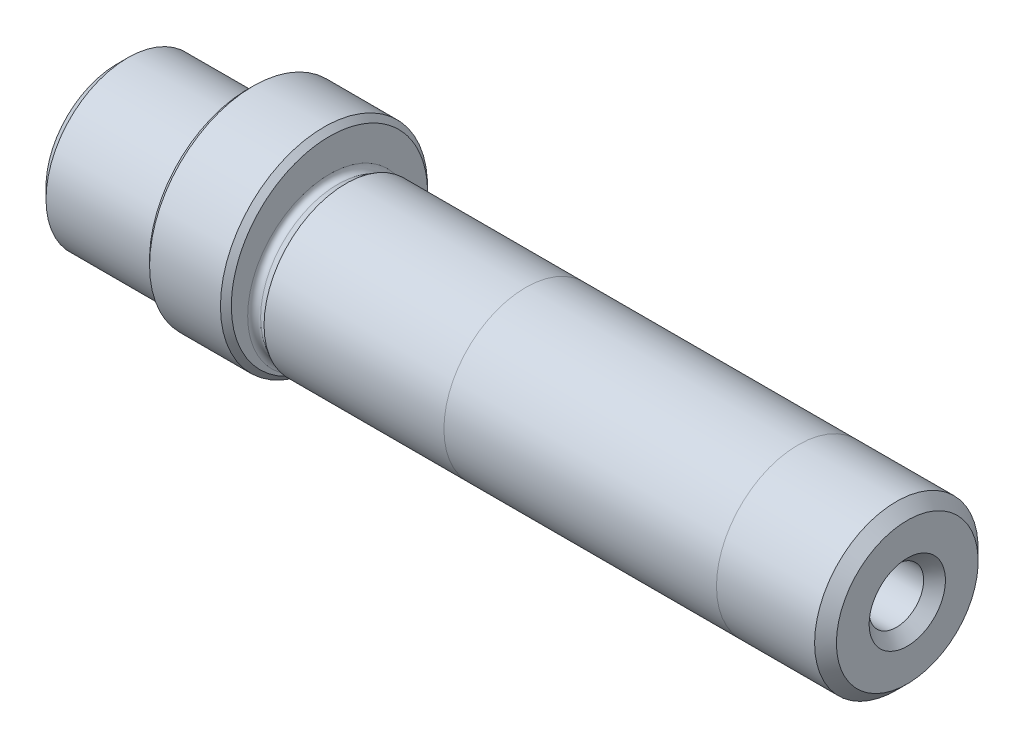
from build123d import *

# Parameters (mm, degrees)
CUT_EXTRUDE1_DEPTH      = 127.059509756
CUT_EXTRUDE1_DEPTH_BACK = 127.059509756
SKETCH3_OUTSIDE_W       = 84.264
SKETCH3_OUTSIDE_H       = 84.264
SKETCH3_OUTSIDE_R       = 19
CHAMFER1_SIZE           = 1
CUT_EXTRUDE2_DEPTH      = 148.885090526
CUT_EXTRUDE2_DEPTH_BACK = 148.885090526
SKETCH6_R               = 5
CHAMFER3_SIZE           = 2


with BuildPart() as part:
    # Sketch2 → Revolve1 (revolve)
    with BuildSketch(Plane.XY, mode=Mode.PRIVATE) as revolve1_sk:
        Polygon((0, 0), (145, 0), (145, 15), (39, 15), (39, 25), (24, 25), (24, 15.2), (0, 15.2), align=None)
    revolve(revolve1_sk.sketch.rotate(Axis((0, 0, 0), (1, 0, 0)), 90), axis=Axis((0, 0, 0), (1, 0, 0)))

    # Sketch3 outside → Cut-Extrude1 (cut, two sides: drawn at the far end of the back side and taken through both)
    with BuildSketch(Plane.ZY.offset(-24).offset(-CUT_EXTRUDE1_DEPTH_BACK)):
        Rectangle(SKETCH3_OUTSIDE_W, SKETCH3_OUTSIDE_H)
        with Locations((0, 3)):
            Circle(SKETCH3_OUTSIDE_R, mode=Mode.SUBTRACT)
    extrude(amount=CUT_EXTRUDE1_DEPTH + CUT_EXTRUDE1_DEPTH_BACK, mode=Mode.SUBTRACT)

    # Sketch4 → Cut-Revolve1 (revolve, cut)
    with BuildSketch(Plane.XY, mode=Mode.PRIVATE) as cut_revolve1_sk:
        with BuildLine():
            Line((-1.227130196, 15), (21, 15))
            Line((21, 15), (22.5, 14.133974596))
            ThreePointArc((22.5, 14.133974596), (23.5, 14.133974596), (24, 15))
            Line((24, 15), (24, 19.086801748))
            Line((24, 19.086801748), (-1.227130196, 19.086801748))
            Line((-1.227130196, 19.086801748), (-1.227130196, 15))
        make_face()
        with BuildLine():
            Line((147.328192088, 15), (42, 15))
            Line((42, 15), (40.5, 14.133974596))
            ThreePointArc((40.5, 14.133974596), (39.5, 14.133974596), (39, 15))
            Line((39, 15), (39, 21.506103324))
            Line((39, 21.506103324), (147.328192088, 21.506103324))
            Line((147.328192088, 21.506103324), (147.328192088, 15))
        make_face()
    revolve(cut_revolve1_sk.sketch.rotate(Axis((0, 0, 0), (1, 0, 0)), 90), axis=Axis((0, 0, 0), (1, 0, 0)), mode=Mode.SUBTRACT)

    # Chamfer1
    chamfer1_edges = [part.edges().sort_by_distance(p)[0] for p in [
        (39, 3, -19),
        (24, 3, -19),
    ]]
    chamfer(chamfer1_edges, length=CHAMFER1_SIZE - 0.0001)  # a hair under: the kernel refuses the full size

    # Sketch6 → Cut-Extrude2 (cut, two sides: drawn at the far end of the back side and taken through both)
    with BuildSketch(Plane.ZY.offset(-CUT_EXTRUDE2_DEPTH_BACK)):
        Circle(SKETCH6_R)
    extrude(amount=CUT_EXTRUDE2_DEPTH + CUT_EXTRUDE2_DEPTH_BACK, mode=Mode.SUBTRACT)

    # Chamfer3
    chamfer3_edges = [part.edges().sort_by_distance(p)[0] for p in [
        (0, 0, -15),
        (145, 0, -5),
        (0, 0, -5),
        (145, 0, -15),
    ]]
    chamfer(chamfer3_edges, length=CHAMFER3_SIZE)


solid = part.part
